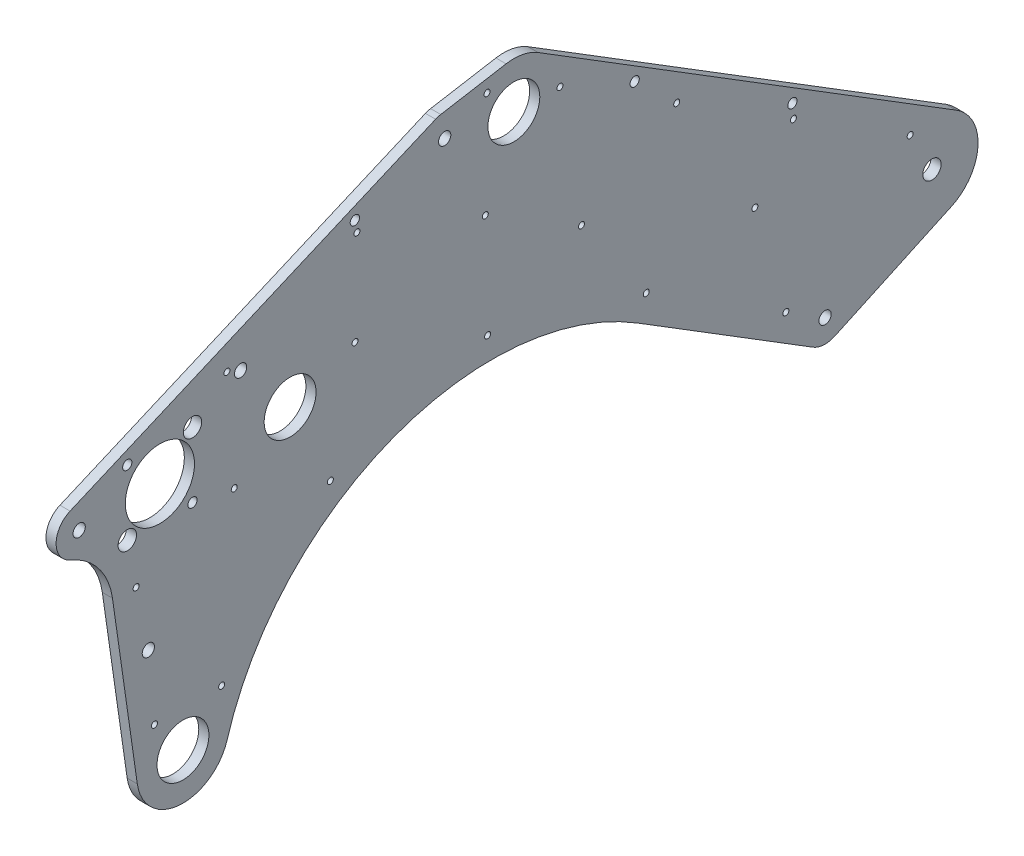
from build123d import *

# Parameters (mm, degrees)
SKETCH2_R           = 14.2875
SKETCH2_R_2         = 19.05
SKETCH2_R_3         = 5.0419
SKETCH2_R_4         = 3.3782
SKETCH2_R_5         = 5.08
SKETCH2_R_6         = 2.5527
BOSS_EXTRUDE1_DEPTH = 5.588
SKETCH4_R           = 2.5527
CUT_EXTRUDE1_DEPTH  = 511.745630356
SKETCH6_R           = 1.651
CUT_EXTRUDE2_DEPTH  = 511.745630356


with BuildPart() as part:
    # Sketch2 → Boss-Extrude1 (new body)
    with BuildSketch(Plane(origin=(0, 0, 0), x_dir=(0, 0, -1), z_dir=(1, 0, 0))):
        with BuildLine():
            Line((-437.587260272, -74.249025346), (-451.263080644, 21.16359127))
            ThreePointArc((-451.263080644, 21.16359127), (-458.898486505, 39.142757806), (-474.440076207, 50.97529099))
            ThreePointArc((-474.440076207, 50.97529099), (-482.293941849, 62.630010732), (-474.595734048, 74.388126842))
            Line((-474.595734048, 74.388126842), (-273.332074414, 160.61819547))
            ThreePointArc((-273.332074414, 160.61819547), (-271.929682825, 161.123852669), (-270.477699488, 161.461692512))
            Line((-270.477699488, 161.461692512), (-234.524836093, 167.628872882))
            ThreePointArc((-234.524836093, 167.628872882), (-225.375591915, 167.526203961), (-216.856353214, 164.18827318))
            Line((-216.856353214, 164.18827318), (13.37420967, 21.593761037))
            ThreePointArc((13.37420967, 21.593761037), (25.353240413, -1.540519571), (10.661298989, -23.05421228))
            Line((10.661298989, -23.05421228), (-53.518911784, -52.734012568))
            ThreePointArc((-53.518911784, -52.734012568), (-59.619821064, -53.883526634), (-65.536666113, -52.003786946))
            Line((-65.536666113, -52.003786946), (-161.935228124, 7.701170333))
            ThreePointArc((-161.935228124, 7.701170333), (-296.157302828, 20.659701711), (-388.120831606, -77.961788077))
            ThreePointArc((-388.120831606, -77.961788077), (-414.345303002, -95.973943021), (-437.587260272, -74.249025346))
        make_face()
        with Locations((-230.230562883, 142.594512143)):
            Circle(SKETCH2_R, mode=Mode.SUBTRACT)
        with Locations((-353.440471878, 63.406794563)):
            Circle(SKETCH2_R, mode=Mode.SUBTRACT)
        with Locations((-412.444222517, -70.645186775)):
            Circle(SKETCH2_R, mode=Mode.SUBTRACT)
        with Locations((-425.144222517, 62.714443515)):
            Circle(SKETCH2_R_2, mode=Mode.SUBTRACT)
        Circle(SKETCH2_R_3, mode=Mode.SUBTRACT)
        with Locations((-58.849561279, -41.206906428)):
            Circle(SKETCH2_R_4, mode=Mode.SUBTRACT)
        with Locations((-268.330562883, 148.944512143)):
            Circle(SKETCH2_R_4, mode=Mode.SUBTRACT)
        with Locations((-407.183710275, 80.674955757)):
            Circle(SKETCH2_R_5, mode=Mode.SUBTRACT)
        with Locations((-443.104734759, 80.674955757)):
            Circle(SKETCH2_R_6, mode=Mode.SUBTRACT)
        with Locations((-443.104734759, 44.753931273)):
            Circle(SKETCH2_R_5, mode=Mode.SUBTRACT)
        with Locations((-407.183710275, 44.753931273)):
            Circle(SKETCH2_R_6, mode=Mode.SUBTRACT)
        with Locations((-469.594222517, 62.714443515)):
            Circle(SKETCH2_R_4, mode=Mode.SUBTRACT)
        with Locations((-431.494222517, -13.485556485)):
            Circle(SKETCH2_R_4, mode=Mode.SUBTRACT)
        with Locations((-380.694222517, 94.464443515)):
            Circle(SKETCH2_R_4, mode=Mode.SUBTRACT)
    extrude(amount=BOSS_EXTRUDE1_DEPTH)

    # Sketch4 → Cut-Extrude1 (cut, through all)
    with BuildSketch(Plane(origin=(5.588, 0, 0), x_dir=(0, 0, -1), z_dir=(1, 0, 0))):
        with Locations((-317.802075062, 134.657047429)):
            Circle(SKETCH4_R)
        with Locations((-163.709288751, 123.802071722)):
            Circle(SKETCH4_R)
        with Locations((-76.839315749, 69.99869625)):
            Circle(SKETCH4_R)
    extrude(amount=-CUT_EXTRUDE1_DEPTH, mode=Mode.SUBTRACT)

    # Sketch6 → Cut-Extrude2 (cut, through all)
    with BuildSketch(Plane(origin=(5.588, 0, 0), x_dir=(0, 0, -1), z_dir=(1, 0, 0))):
        with Locations((-12.013640786, 22.379285848)):
            Circle(SKETCH6_R)
        with Locations((-157.328367854, 19.765324833)):
            Circle(SKETCH6_R)
        with Locations((-76.285948152, 62.186678048)):
            Circle(SKETCH6_R)
        with Locations((-244.659694601, 43.219988664)):
            Circle(SKETCH6_R)
        with Locations((-244.98319623, 158.947535205)):
            Circle(SKETCH6_R)
        with Locations((-331.247306208, 17.153393123)):
            Circle(SKETCH6_R)
        with Locations((-391.116574556, -50.614981465)):
            Circle(SKETCH6_R)
        with Locations((-438.241263323, 19.823896263)):
            Circle(SKETCH6_R)
        with Locations((-316.603490621, 128.262299173)):
            Circle(SKETCH6_R)
        with Locations((-388.223785012, 97.577063141)):
            Circle(SKETCH6_R)
        with Locations((-140.558255518, 101.994070248)):
            Circle(SKETCH6_R)
        with Locations((-80.443322315, -27.832696758)):
            Circle(SKETCH6_R)
        with Locations((-428.136757148, -50.672596637)):
            Circle(SKETCH6_R)
        with Locations((-204.830562883, 141.801462448)):
            Circle(SKETCH6_R)
        with Locations((-245.956481848, 101.080589085)):
            Circle(SKETCH6_R)
        with Locations((-384.206661631, 40.028565642)):
            Circle(SKETCH6_R)
        with Locations((-317.695033592, 76.472670665)):
            Circle(SKETCH6_R)
        with Locations((-192.98283431, 69.861322371)):
            Circle(SKETCH6_R)
        with Locations((-97.487672784, 30.530764341)):
            Circle(SKETCH6_R)
    extrude(amount=-CUT_EXTRUDE2_DEPTH, mode=Mode.SUBTRACT)


solid = part.part
